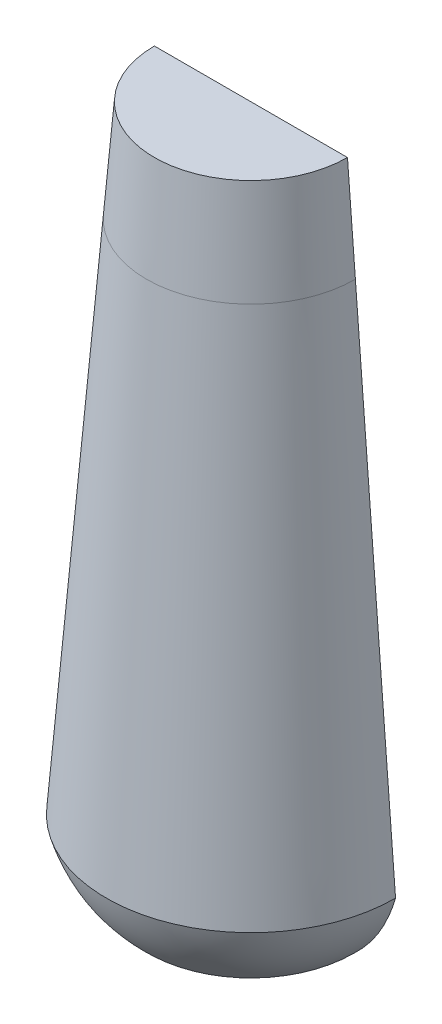
from build123d import *

# Parameters (mm, degrees)
REVOLVE1_ANGLE = 180


with BuildPart() as part:
    # Sketch1 → Revolve1 (revolve)
    with BuildSketch(Plane.XY):
        with BuildLine():
            Line((27.686, 0), (22.606, 0))
            Line((22.606, 0), (22.606, 1.8288))
            add(Edge.make_bspline(
                [(22.606, 1.8288), (25.041168082, 1.8288), (27.106875675, 2.820982452), (28.829, 4.191)],
                knots=[0, 0, 0, 0, 0.286842678, 0.286842678, 0.286842678, 0.286842678], degree=3))
            Line((28.829, 4.191), (22.606, 4.191))
            Line((22.606, 4.191), (22.606, 5.8928))
            Line((22.606, 5.8928), (30.607, 5.8928))
            add(Edge.make_bspline(
                [(30.607, 5.8928), (35.326430108, 11.240557446), (36.542913871, 18.669)],
                knots=[0.392904056, 0.392904056, 0.392904056, 1, 1, 1], degree=2))
            Line((36.542913871, 18.669), (0, 18.669))
            Line((0, 18.669), (0, 185.547))
            Line((0, 185.547), (26.0985, 185.547))
            Line((26.0985, 185.547), (39.0906, 18.669))
            add(Edge.make_bspline(
                [(27.686, 0), (33.019237831, 4.973324735), (36.732929961, 10.734198825), (39.0906, 18.669)],
                knots=[0, 0, 0, 0, 1, 1, 1, 1], degree=3))
        make_face()
    revolve(axis=Axis((0, 18.669, 0), (0, -1, 0)), revolution_arc=REVOLVE1_ANGLE)


solid = part.part
